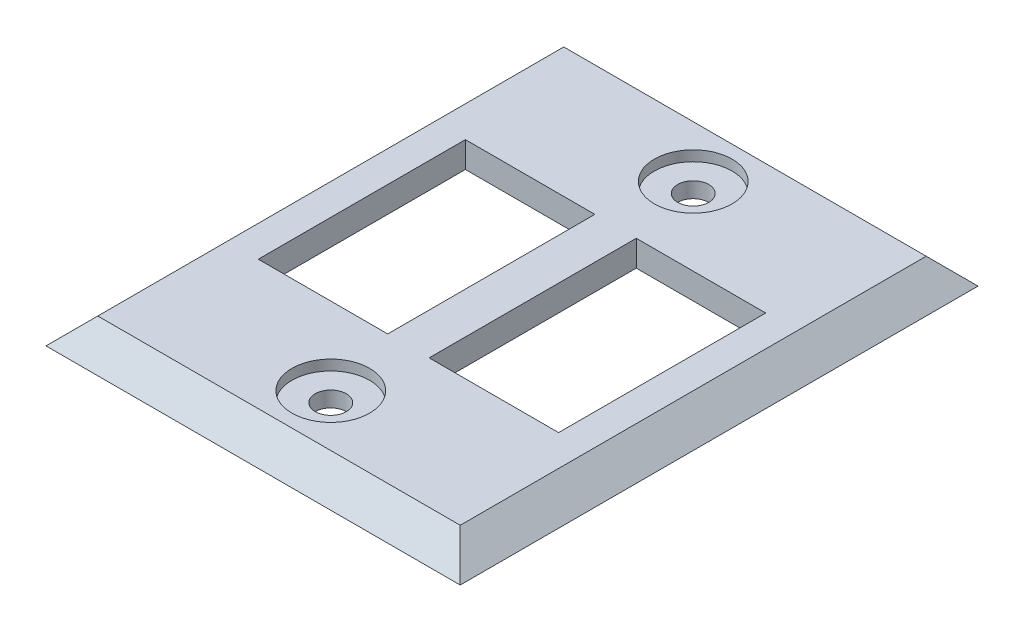
from build123d import *

# Parameters (mm, degrees)
SKETCH1_W           = 40
SKETCH1_H           = 50
SKETCH1_W_2         = 12.5
SKETCH1_H_2         = 20
BOSS_EXTRUDE1_DEPTH = 2.5
SKETCH2_R           = 1.5
CUT_EXTRUDE1_DEPTH  = 10
SKETCH3_R           = 3.75
CUT_EXTRUDE2_DEPTH  = 1
CHAMFER1_SIZE       = 2.5


with BuildPart() as part:
    # Sketch1 → Boss-Extrude1 (new body)
    with BuildSketch(Plane(origin=(0, 0, 0), x_dir=(1, 0, 0), z_dir=(0, 1, 0))):
        Rectangle(SKETCH1_W, SKETCH1_H)
        with Locations((-8.25, 0)):
            Rectangle(SKETCH1_W_2, SKETCH1_H_2, mode=Mode.SUBTRACT)
        with Locations((8.25, 0)):
            Rectangle(SKETCH1_W_2, SKETCH1_H_2, mode=Mode.SUBTRACT)
    extrude(amount=BOSS_EXTRUDE1_DEPTH)

    # Sketch2 → Cut-Extrude1 (cut)
    with BuildSketch(Plane(origin=(0, 2.5, 0), x_dir=(1, 0, 0), z_dir=(0, 1, 0))):
        with Locations(Location((0, 17.5, 0), (0, 0, 270))):
            Circle(SKETCH2_R)
        with Locations(Location((0, -17.5, 0), (0, 0, 270))):
            Circle(SKETCH2_R)
    extrude(amount=-CUT_EXTRUDE1_DEPTH, mode=Mode.SUBTRACT)

    # Sketch3 → Cut-Extrude2 (cut)
    with BuildSketch(Plane(origin=(0, 2.5, 0), x_dir=(1, 0, 0), z_dir=(0, 1, 0))):
        with Locations(Location((0, 17.5, 0), (0, 0, 270))):
            Circle(SKETCH3_R)
        with Locations(Location((0, -17.5, 0), (0, 0, 270))):
            Circle(SKETCH3_R)
    extrude(amount=-CUT_EXTRUDE2_DEPTH, mode=Mode.SUBTRACT)

    # Chamfer1
    chamfer1_edges = [part.edges().sort_by_distance(p)[0] for p in [
        (20, 2.5, 0),
        (0, 2.5, 25),
        (0, 2.5, -25),
        (-20, 2.5, 0),
    ]]
    chamfer(chamfer1_edges, length=CHAMFER1_SIZE - 0.0001)  # a hair under: the kernel refuses the full size


solid = part.part
